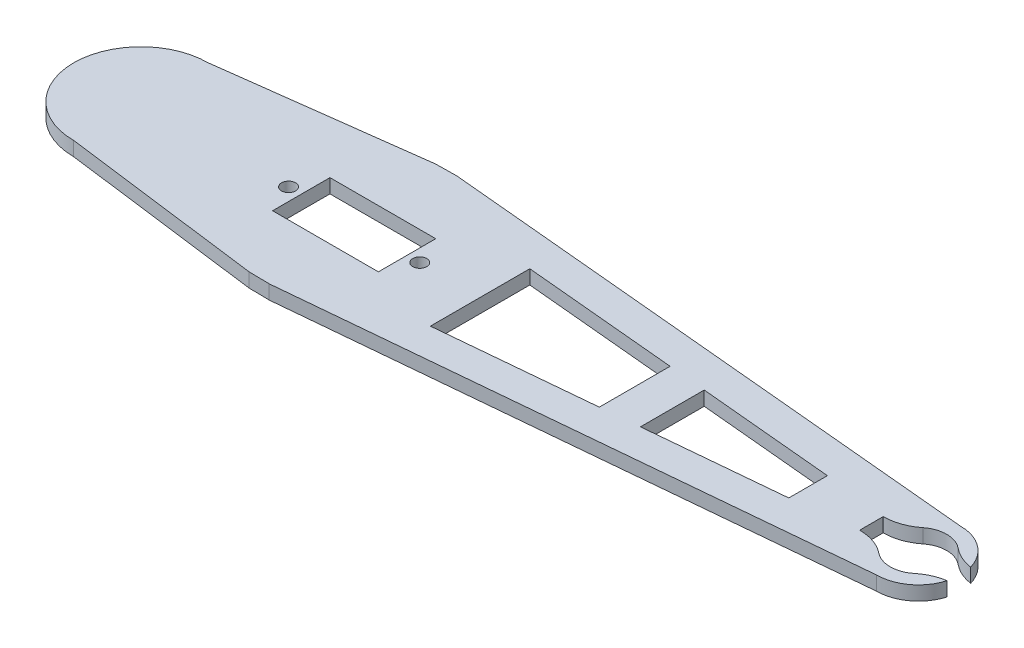
from build123d import *

# Parameters (mm, degrees)
SKETCH1_R           = 1.5
SKETCH1_R_2         = 6
SKETCH1_W           = 22.5
SKETCH1_H           = 12.2
BOSS_EXTRUDE1_DEPTH = 3
SKETCH3_W           = 20
SKETCH3_H           = 5
CUT_EXTRUDE1_DEPTH  = 131.520857309
FILLET1_R           = 10


with BuildPart() as part:
    # Sketch1 → Boss-Extrude1 (new body)
    with BuildSketch(Plane(origin=(0, 0, 0), x_dir=(1, 0, 0), z_dir=(0, 1, 0))):
        with BuildLine():
            Line((1.846751087, 19.91455524), (120, 8.957763171))
            ThreePointArc((120, 8.957763171), (128.957763171, 0), (120, -8.957763171))
            Line((120, -8.957763171), (1.846751087, -19.91455524))
            Line((1.846751087, -19.91455524), (-2.565887989, -19.834722555))
            Line((-2.565887989, -19.834722555), (-45.343490518, -14.300864634))
            ThreePointArc((-45.343490518, -14.300864634), (-59.644355152, 0), (-45.343490518, 14.300864634))
            Line((-45.343490518, 14.300864634), (-2.565887989, 19.834722555))
            Line((-2.565887989, 19.834722555), (1.846751087, 19.91455524))
        make_face()
        with Locations(Location((13.95, 0, 0), (0, 0, 270))):
            Circle(SKETCH1_R, mode=Mode.SUBTRACT)
        with Locations(Location((-13.95, 0, 0), (0, 0, 270))):
            Circle(SKETCH1_R, mode=Mode.SUBTRACT)
        with Locations(Location((120, 0, 0), (0, 0, 270))):
            Circle(SKETCH1_R_2, mode=Mode.SUBTRACT)
        Rectangle(SKETCH1_W, SKETCH1_H, mode=Mode.SUBTRACT)
        Polygon((96.529167285, 4.104267173), (67.660347399, 6.781380665), (67.660347399, -6.781380665), (96.529167285, -4.104267173), align=None, mode=Mode.SUBTRACT)
        Polygon((59.65913304, 7.523363157), (26.779600723, 10.572404992), (26.779600723, -10.572404992), (59.65913304, -7.523363157), align=None, mode=Mode.SUBTRACT)
    extrude(amount=BOSS_EXTRUDE1_DEPTH)

    # Sketch3 → Cut-Extrude1 (cut, through all)
    with BuildSketch(Plane(origin=(0, 3, 0), x_dir=(1, 0, 0), z_dir=(0, 1, 0))):
        with Locations((120, 0)):
            Rectangle(SKETCH3_W, SKETCH3_H)
    extrude(amount=-CUT_EXTRUDE1_DEPTH, mode=Mode.SUBTRACT)

    # Fillet1
    # the kernel refuses this fillet: 10 mm, written as the material it takes off along each edge
    with BuildSketch(Plane(origin=(125.454356057, 10.868690914, 2.5), x_dir=(1, 0, 0), z_dir=(0, -1, 0))) as fillet1_piece_1:
        with BuildLine():
            CenterArc((4.679032278, 9.882020871), FILLET1_R, 230.703265247, 30.48689252)
            Line((-1.654335431, 2.143257826), (-1.781002786, 1.988482566))
            ThreePointArc((-1.781002786, 1.988482566), (-0.863019038, 1.043956035), (-0.181811869, -0.083333333))
            Line((-0.181811869, -0.083333333), (0, -0.2))
            ThreePointArc((0, -0.2), (1.573738183, -0.2), (3.116845247, -0.197640417))
            Line((3.116845247, -0.197640417), (3.147476366, 0))
        make_face()
    extrude(amount=18.737381828, mode=Mode.SUBTRACT)
    with BuildSketch(Plane(origin=(114.545643943, 14.332840301, 2.5), x_dir=(0.6156579371182371, 0, 0.7880135179445317), z_dir=(0, -1, 0))) as fillet1_piece_2:
        with BuildLine():
            CenterArc((5.089273947, 9.728751913), FILLET1_R, 217.99974274, 38.624832873)
            Line((-2.790861233, 3.572172542), (-2.948463936, 3.449040954))
            Line((-2.948463936, 3.449040954), (-0.157602704, -0.123131587))
            Line((-0.157602704, -0.123131587), (0.046266127, -0.194575038))
            ThreePointArc((0.046266127, -0.194575038), (1.387983804, -0.037251148), (2.729701481, -0.194575038))
            Line((2.729701481, -0.194575038), (2.775967607, 0))
        make_face()
    extrude(amount=25.665680602, mode=Mode.SUBTRACT)
    with BuildSketch(Plane(origin=(114.545643943, 14.332840301, -2.5), x_dir=(-1, 0, 0), z_dir=(0, -1, 0))) as fillet1_piece_3:
        with BuildLine():
            CenterArc((4.53313612, 10), FILLET1_R, 231.375167127, 38.624832873)
            Line((-1.709046491, 2.1875), (-1.833890143, 2.03125))
            ThreePointArc((-1.833890143, 2.03125), (-0.883877653, 1.070816035), (-0.181811869, -0.083333333))
            Line((-0.181811869, -0.083333333), (0, -0.2))
            Line((0, -0.2), (4.53313612, -0.2))
            Line((4.53313612, -0.2), (4.53313612, 0))
        make_face()
    extrude(amount=25.665680602, mode=Mode.SUBTRACT)
    with BuildSketch(Plane(origin=(125.454356057, 10.868690914, -2.5), x_dir=(-0.6110269025667731, 0, -0.7916098308760795), z_dir=(0, -1, 0))) as fillet1_piece_4:
        with BuildLine():
            CenterArc((4.96369027, 9.742148554), FILLET1_R, 226.473634032, 30.48689252)
            Line((-1.923192735, 2.491573233), (-2.060930395, 2.346561727))
            ThreePointArc((-2.060930395, 2.346561727), (-1.119918333, 1.123581236), (-0.158321966, -0.122205381))
            Line((-0.158321966, -0.122205381), (0.045124457, -0.194842971))
            ThreePointArc((0.045124457, -0.194842971), (1.35373371, -0.045289132), (2.662342963, -0.194842971))
            Line((2.662342963, -0.194842971), (2.70746742, 0))
        make_face()
    extrude(amount=18.737381828, mode=Mode.SUBTRACT)


solid = part.part
